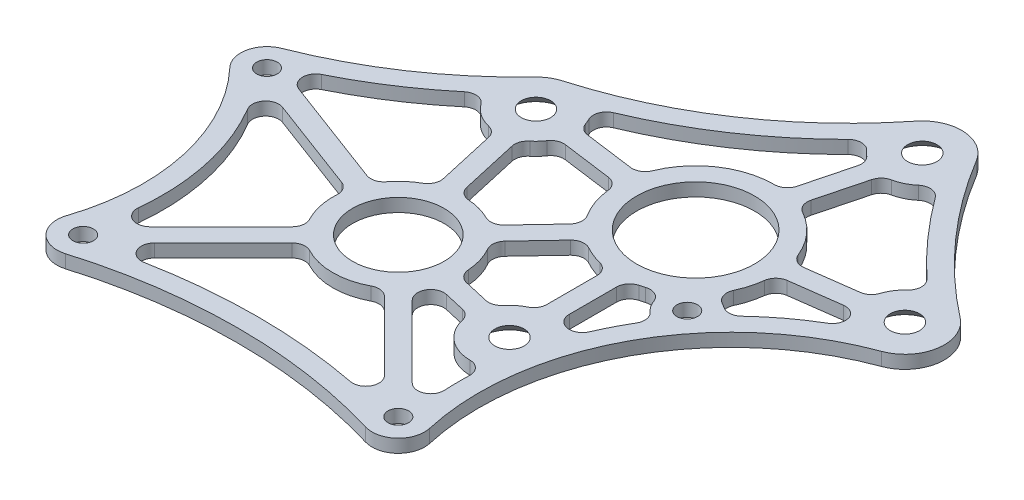
from build123d import *
from build123d.topology import SkipClean

# Parameters (mm, degrees)
LOWEREDBALLAST_DECK_MOUNT_START         = 6.35
LOWEREDBALLAST_DECK_MOUNT_OUTLINE_R     = 2.5527
LOWEREDBALLAST_DECK_MOUNT_OUTLINE_R_2   = 2.4892
LOWEREDBALLAST_DECK_MOUNT_OUTLINE_R_3   = 14.2875
LOWEREDBALLAST_DECK_MOUNT_OUTLINE_R_4   = 8.73125
LOWEREDBALLAST_DECK_MOUNT_DEPTH         = 5.9944
LOWEREDBALLAST_DECK_MOUNT_2_OUTLINE_R   = 8.73125
LOWEREDBALLAST_DECK_MOUNT_2_OUTLINE_R_2 = 7.14375
LOWEREDBALLAST_DECK_MOUNT_2_DEPTH       = 2.2098
BODY_MOVE_COPY2_START                   = 12.3444
BODY_MOVE_COPY2_OUTLINE_W               = 5.9944
BODY_MOVE_COPY2_OUTLINE_H               = 321.85
BODY_MOVE_COPY2_DEPTH                   = 184.5056
BODY_MOVE_COPY2_START_2                 = 3.175
BODY_MOVE_COPY2_2_OUTLINE_W             = 5.9944
BODY_MOVE_COPY2_2_OUTLINE_H             = 131.35
BODY_MOVE_COPY2_2_DEPTH                 = 9.1694
BODY_MOVE_COPY2_3_DEPTH                 = 3.175
BODY_MOVE_COPY2_START_3                 = 8.5598
BODY_MOVE_COPY2_4_DEPTH                 = 3.7846
BODY_MOVE_COPY2_START_4                 = 6.35
BODY_MOVE_COPY2_5_OUTLINE_R             = 2.4892
BODY_MOVE_COPY2_5_OUTLINE_R_2           = 2.5527
BODY_MOVE_COPY2_5_DEPTH                 = 5.9944
BODY_MOVE_COPY2_6_DEPTH                 = 2.2098
SKETCH2_R                               = 2.4892
SKETCH2_R_2                             = 11.0871
BOSS_EXTRUDE2_DEPTH                     = 3.175
BOSS_EXTRUDE3_DEPTH                     = 3.175
CSK_FOR_M6_SFHCS1_AT_2_COUNT            = 2
CSK_FOR_M6_SFHCS1_AT_2_PITCH            = 67.31314879
CSK_FOR_M6_SFHCS1_AT_3_COUNT            = 2
CSK_FOR_M6_SFHCS1_AT_3_PITCH            = 89.2
CSK_FOR_M6_SFHCS1_AT_4_COUNT            = 2
CSK_FOR_M6_SFHCS1_AT_4_PITCH            = 67.750719553
SKETCH9_R                               = 14.2621
CUT_EXTRUDE1_DEPTH                      = 127.63845982
SKETCH11_R                              = 15.8496
CUT_EXTRUDE3_DEPTH                      = 127.63845982
SKETCH12_W                              = 4.7625
SKETCH12_H                              = 16.902473543
BOSS_EXTRUDE4_DEPTH                     = 3.175
FILLET1_R                               = 3.175
BOSS_EXTRUDE10_DEPTH                    = 3.175


# Read off the part's stored shape, not the designer's step: LoweredBallast_Deck_Mount, Body-Move/Copy2
with BuildPart() as part:
    # LoweredBallast_Deck_Mount outline → LoweredBallast_Deck_Mount (new body)
    with BuildSketch(Plane.YZ.offset(LOWEREDBALLAST_DECK_MOUNT_START)):
        with BuildLine():
            Line((6.35, 95.898234913), (6.35, -95.898234913))
            ThreePointArc((6.35, -95.898234913), (5.815203263, -101.082988202), (4.233333333, -106.049411638))
            ThreePointArc((4.233333333, -106.049411638), (6.894743879, -120.105256121), (20.950588362, -122.766666667))
            ThreePointArc((20.950588362, -122.766666667), (25.917011798, -121.184796737), (31.101765087, -120.65))
            Line((31.101765087, -120.65), (104.656174089, -120.65))
            ThreePointArc((104.656174089, -120.65), (107.566222296, -120.194577963), (110.197992271, -118.871862348))
            Line((110.197992271, -118.871862348), (192.866818182, -59.73364846))
            ThreePointArc((192.866818182, -59.73364846), (195.795874901, -56.342231371), (196.85, -51.986786112))
            Line((196.85, -51.986786112), (196.85, 51.986786112))
            ThreePointArc((196.85, 51.986786112), (195.795874901, 56.342231371), (192.866818182, 59.73364846))
            Line((192.866818182, 59.73364846), (110.197992271, 118.871862348))
            ThreePointArc((110.197992271, 118.871862348), (107.566222296, 120.194577963), (104.656174089, 120.65))
            Line((104.656174089, 120.65), (31.101765087, 120.65))
            ThreePointArc((31.101765087, 120.65), (25.917011798, 121.184796737), (20.950588362, 122.766666667))
            ThreePointArc((20.950588362, 122.766666667), (6.894743879, 120.105256121), (4.233333333, 106.049411638))
            ThreePointArc((4.233333333, 106.049411638), (5.815203263, 101.082988202), (6.35, 95.898234913))
        make_face()
        with Locations((15.875, -111.125)):
            Circle(LOWEREDBALLAST_DECK_MOUNT_OUTLINE_R, mode=Mode.SUBTRACT)
        with Locations((50.8, -50.401562476)):
            Circle(LOWEREDBALLAST_DECK_MOUNT_OUTLINE_R_2, mode=Mode.SUBTRACT)
        with Locations((69.9008, -38.1)):
            Circle(LOWEREDBALLAST_DECK_MOUNT_OUTLINE_R_2, mode=Mode.SUBTRACT)
        with Locations((104.656174089, -111.125)):
            Circle(LOWEREDBALLAST_DECK_MOUNT_OUTLINE_R, mode=Mode.SUBTRACT)
        with Locations((127.0508, -50.8)):
            Circle(LOWEREDBALLAST_DECK_MOUNT_OUTLINE_R_2, mode=Mode.SUBTRACT)
        with Locations((187.325, -51.986786112)):
            Circle(LOWEREDBALLAST_DECK_MOUNT_OUTLINE_R, mode=Mode.SUBTRACT)
        with Locations((15.875, 0)):
            Circle(LOWEREDBALLAST_DECK_MOUNT_OUTLINE_R, mode=Mode.SUBTRACT)
        with Locations((50.8, 50.401562476)):
            Circle(LOWEREDBALLAST_DECK_MOUNT_OUTLINE_R_2, mode=Mode.SUBTRACT)
        with Locations((57.15, 0)):
            Circle(LOWEREDBALLAST_DECK_MOUNT_OUTLINE_R_3, mode=Mode.SUBTRACT)
        with Locations((69.9008, 38.1)):
            Circle(LOWEREDBALLAST_DECK_MOUNT_OUTLINE_R_2, mode=Mode.SUBTRACT)
        with Locations((15.875, 111.125)):
            Circle(LOWEREDBALLAST_DECK_MOUNT_OUTLINE_R, mode=Mode.SUBTRACT)
        with Locations((108.0008, 0)):
            Circle(LOWEREDBALLAST_DECK_MOUNT_OUTLINE_R_4, mode=Mode.SUBTRACT)
        with Locations((127.0508, 50.8)):
            Circle(LOWEREDBALLAST_DECK_MOUNT_OUTLINE_R_2, mode=Mode.SUBTRACT)
        with Locations((187.325, 51.986786112)):
            Circle(LOWEREDBALLAST_DECK_MOUNT_OUTLINE_R, mode=Mode.SUBTRACT)
        with Locations((104.656174089, 111.125)):
            Circle(LOWEREDBALLAST_DECK_MOUNT_OUTLINE_R, mode=Mode.SUBTRACT)
    extrude(amount=LOWEREDBALLAST_DECK_MOUNT_DEPTH)

    # LoweredBallast_Deck_Mount 2 outline → LoweredBallast_Deck_Mount 2 (add)
    with BuildSketch(Plane.YZ.offset(LOWEREDBALLAST_DECK_MOUNT_START)):
        with Locations((108.0008, 0)):
            Circle(LOWEREDBALLAST_DECK_MOUNT_2_OUTLINE_R)
        with Locations((108.0008, 0)):
            Circle(LOWEREDBALLAST_DECK_MOUNT_2_OUTLINE_R_2, mode=Mode.SUBTRACT)
    extrude(amount=LOWEREDBALLAST_DECK_MOUNT_2_DEPTH)

    # Body-Move/Copy2 outline → Body-Move/Copy2 (cut)
    with BuildSketch(Plane(origin=(0, 0, 0), x_dir=(1, 0, 0), z_dir=(0, 1, 0)).offset(BODY_MOVE_COPY2_START)):
        with Locations((9.3472, 35.925)):
            Rectangle(BODY_MOVE_COPY2_OUTLINE_W, BODY_MOVE_COPY2_OUTLINE_H)
    extrude(amount=BODY_MOVE_COPY2_DEPTH, mode=Mode.SUBTRACT)

    # Body-Move_Copy2 2 outline → Body-Move_Copy2 2 (cut)
    with BuildSketch(Plane(origin=(0, 0, 0), x_dir=(1, 0, 0), z_dir=(0, 1, 0)).offset(BODY_MOVE_COPY2_START_2)):
        with BuildLine():
            ThreePointArc((6.35, 104.72808491), (7.14375, 108.0008), (6.35, 111.27351509))
            Line((6.35, 111.27351509), (6.35, 104.72808491))
        make_face()
        with BuildLine():
            Line((6.35, 69.948834175), (6.35, 44.351165825))
            ThreePointArc((6.35, 44.351165825), (9.758314431, 46.714102544), (12.3444, 49.956360803))
            Line((12.3444, 49.956360803), (12.3444, 64.343639197))
            ThreePointArc((12.3444, 64.343639197), (9.758314431, 67.585897456), (6.35, 69.948834175))
        make_face()
        with Locations((9.3472, -59.325)):
            Rectangle(BODY_MOVE_COPY2_2_OUTLINE_W, BODY_MOVE_COPY2_2_OUTLINE_H)
    extrude(amount=BODY_MOVE_COPY2_2_DEPTH, mode=Mode.SUBTRACT)

    # Body-Move_Copy2 3 outline → Body-Move_Copy2 3 (cut)
    with BuildSketch(Plane(origin=(0, 0, 0), x_dir=(1, 0, 0), z_dir=(0, 1, 0)).offset(BODY_MOVE_COPY2_START_2)):
        with BuildLine():
            ThreePointArc((6.35, 111.27351509), (7.14375, 108.0008), (6.35, 104.72808491))
            Line((6.35, 104.72808491), (6.35, 69.948834175))
            ThreePointArc((6.35, 69.948834175), (9.758314431, 67.585897456), (12.3444, 64.343639197))
            Line((12.3444, 64.343639197), (12.3444, 120.65))
            Line((12.3444, 120.65), (6.35, 120.65))
            Line((6.35, 120.65), (6.35, 111.27351509))
        make_face()
    extrude(amount=BODY_MOVE_COPY2_3_DEPTH, mode=Mode.SUBTRACT)

    # Body-Move_Copy2 4 outline → Body-Move_Copy2 4 (cut)
    with BuildSketch(Plane(origin=(0, 0, 0), x_dir=(1, 0, 0), z_dir=(0, 1, 0)).offset(BODY_MOVE_COPY2_START_3)):
        with BuildLine():
            ThreePointArc((6.35, 111.27351509), (7.14375, 108.0008), (6.35, 104.72808491))
            Line((6.35, 104.72808491), (6.35, 102.008118917))
            ThreePointArc((6.35, 102.008118917), (8.73125, 108.0008), (6.35, 113.993481083))
            Line((6.35, 113.993481083), (6.35, 111.27351509))
        make_face()
    extrude(amount=BODY_MOVE_COPY2_4_DEPTH, mode=Mode.SUBTRACT)

    # Body-Move_Copy2 5 outline → Body-Move_Copy2 5 (add)
    with SkipClean():  # the faces are left unmerged after this step: merging them gives an invalid solid
        with BuildSketch(Plane(origin=(0, 0, 0), x_dir=(1, 0, 0), z_dir=(0, 1, 0)).offset(BODY_MOVE_COPY2_START_4)):
            with BuildLine():
                Line((8.5598, 106.279012986), (8.5598, 68.589513985))
                ThreePointArc((8.5598, 68.589513985), (14.001606829, 59.993881585), (12.3444, 49.956360803))
                Line((12.3444, 49.956360803), (12.3444, 6.35))
                Line((12.3444, 6.35), (95.898234913, 6.35))
                ThreePointArc((95.898234913, 6.35), (101.082988202, 5.815203263), (106.049411638, 4.233333333))
                ThreePointArc((106.049411638, 4.233333333), (120.105256121, 6.894743879), (122.766666667, 20.950588362))
                ThreePointArc((122.766666667, 20.950588362), (121.184796737, 25.917011798), (120.65, 31.101765087))
                Line((120.65, 31.101765087), (120.65, 104.656174089))
                ThreePointArc((120.65, 104.656174089), (120.194577963, 107.566222296), (118.871862348, 110.197992271))
                Line((118.871862348, 110.197992271), (59.73364846, 192.866818182))
                ThreePointArc((59.73364846, 192.866818182), (56.342231371, 195.795874901), (51.986786112, 196.85))
                Line((51.986786112, 196.85), (-51.986786112, 196.85))
                ThreePointArc((-51.986786112, 196.85), (-56.342231371, 195.795874901), (-59.73364846, 192.866818182))
                Line((-59.73364846, 192.866818182), (-118.871862348, 110.197992271))
                ThreePointArc((-118.871862348, 110.197992271), (-120.194577963, 107.566222296), (-120.65, 104.656174089))
                Line((-120.65, 104.656174089), (-120.65, 31.101765087))
                ThreePointArc((-120.65, 31.101765087), (-121.184796737, 25.917011798), (-122.766666667, 20.950588362))
                ThreePointArc((-122.766666667, 20.950588362), (-120.105256121, 6.894743879), (-106.049411638, 4.233333333))
                ThreePointArc((-106.049411638, 4.233333333), (-101.082988202, 5.815203263), (-95.898234913, 6.35))
                Line((-95.898234913, 6.35), (6.35, 6.35))
                Line((6.35, 6.35), (6.35, 44.351165825))
                ThreePointArc((6.35, 44.351165825), (-14.2875, 57.15), (6.35, 69.948834175))
                Line((6.35, 69.948834175), (6.35, 102.008118917))
                ThreePointArc((6.35, 102.008118917), (-7.754719082, 112.013163208), (8.5598, 106.279012986))
            make_face()
            with Locations((-38.1, 69.9008)):
                Circle(BODY_MOVE_COPY2_5_OUTLINE_R, mode=Mode.SUBTRACT)
            with Locations((-111.125, 15.875)):
                Circle(BODY_MOVE_COPY2_5_OUTLINE_R_2, mode=Mode.SUBTRACT)
            with Locations((0, 15.875)):
                Circle(BODY_MOVE_COPY2_5_OUTLINE_R_2, mode=Mode.SUBTRACT)
            with Locations((-111.125, 104.656174089)):
                Circle(BODY_MOVE_COPY2_5_OUTLINE_R_2, mode=Mode.SUBTRACT)
            with Locations((-50.401562476, 50.8)):
                Circle(BODY_MOVE_COPY2_5_OUTLINE_R, mode=Mode.SUBTRACT)
            with Locations((-51.986786112, 187.325)):
                Circle(BODY_MOVE_COPY2_5_OUTLINE_R_2, mode=Mode.SUBTRACT)
            with Locations((-50.8, 127.0508)):
                Circle(BODY_MOVE_COPY2_5_OUTLINE_R, mode=Mode.SUBTRACT)
            with Locations((111.125, 104.656174089)):
                Circle(BODY_MOVE_COPY2_5_OUTLINE_R_2, mode=Mode.SUBTRACT)
            with Locations((111.125, 15.875)):
                Circle(BODY_MOVE_COPY2_5_OUTLINE_R_2, mode=Mode.SUBTRACT)
            with Locations((50.401562476, 50.8)):
                Circle(BODY_MOVE_COPY2_5_OUTLINE_R, mode=Mode.SUBTRACT)
            with Locations((38.1, 69.9008)):
                Circle(BODY_MOVE_COPY2_5_OUTLINE_R, mode=Mode.SUBTRACT)
            with Locations((51.986786112, 187.325)):
                Circle(BODY_MOVE_COPY2_5_OUTLINE_R_2, mode=Mode.SUBTRACT)
            with Locations((50.8, 127.0508)):
                Circle(BODY_MOVE_COPY2_5_OUTLINE_R, mode=Mode.SUBTRACT)
        extrude(amount=BODY_MOVE_COPY2_5_DEPTH)

    # Body-Move_Copy2 6 outline → Body-Move_Copy2 6 (add)
    with SkipClean():  # the faces are left unmerged after this step: merging them gives an invalid solid
        with BuildSketch(Plane(origin=(0, 0, 0), x_dir=(1, 0, 0), z_dir=(0, 1, 0)).offset(BODY_MOVE_COPY2_START_4)):
            with BuildLine():
                ThreePointArc((6.35, 104.72808491), (-7.14375, 108.0008), (6.35, 111.27351509))
                Line((6.35, 111.27351509), (6.35, 113.993481083))
                ThreePointArc((6.35, 113.993481083), (-8.73125, 108.0008), (6.35, 102.008118917))
                Line((6.35, 102.008118917), (6.35, 104.72808491))
            make_face()
        extrude(amount=BODY_MOVE_COPY2_6_DEPTH)


with BuildPart() as body_2:
    # Sketch2 → Boss-Extrude2 (new body)
    with BuildSketch(Plane(origin=(0, 12.3444, 0), x_dir=(1, 0, 0), z_dir=(0, 1, 0))):
        with BuildLine():
            ThreePointArc((-44.129496351, -36.108097954), (-42.655468746, -42.523822386), (-36.285714286, -44.185299282))
            ThreePointArc((-36.285714286, -44.185299282), (0, -38.891284914), (36.285714286, -44.185299282))
            ThreePointArc((36.285714286, -44.185299282), (42.655468746, -42.523822386), (44.129496351, -36.108097954))
            ThreePointArc((44.129496351, -36.108097954), (42.775164497, -9.152814333), (55.418385239, 14.691902046))
            ThreePointArc((55.418385239, 14.691902046), (57.037562574, 20.239669338), (53.490115715, 24.802023769))
            ThreePointArc((53.490115715, 24.802023769), (50.38290358, 27.963007244), (50.100359739, 32.38643948))
            ThreePointArc((50.100359739, 32.38643948), (44.410724144, 49.657761114), (26.234915901, 50.214985411))
            ThreePointArc((26.234915901, 50.214985411), (-10.729896119, 32.563223651), (-51.060943402, 25.394636202))
            ThreePointArc((-51.060943402, 25.394636202), (-56.681249153, 21.444453674), (-55.418385239, 14.691902046))
            ThreePointArc((-55.418385239, 14.691902046), (-42.775164497, -9.152814333), (-44.129496351, -36.108097954))
        make_face()
        with Locations(Location((-50.8, 19.05, 0), (0, 0, 270))):
            Circle(SKETCH2_R, mode=Mode.SUBTRACT)
        with Locations(Location((50.8, 19.05, 0), (0, 0, 270))):
            Circle(SKETCH2_R, mode=Mode.SUBTRACT)
        with Locations(Location((38.1, -38.1, 0), (0, 0, 270))):
            Circle(SKETCH2_R, mode=Mode.SUBTRACT)
        with Locations(Location((0, 0, 0), (0, 0, 270))):
            Circle(SKETCH2_R_2, mode=Mode.SUBTRACT)
        with Locations(Location((34.925, 36.960089768, 0), (0, 0, 270))):
            Circle(SKETCH2_R_2, mode=Mode.SUBTRACT)
        with Locations(Location((-38.1, -38.1, 0), (0, 0, 270))):
            Circle(SKETCH2_R, mode=Mode.SUBTRACT)
    extrude(amount=BOSS_EXTRUDE2_DEPTH)

    # Sketch5 → Boss-Extrude3 (add)
    with BuildSketch(Plane(origin=(0, 15.5194, 0), x_dir=(1, 0, 0), z_dir=(0, 1, 0))):
        with BuildLine():
            ThreePointArc((44.293527545, -36.699030141), (50.216262385, 5.917629746), (82.800587261, 34.016032909))
            ThreePointArc((82.800587261, 34.016032909), (88.936638085, 41.494929858), (85.364424768, 50.485164078))
            ThreePointArc((85.364424768, 50.485164078), (68.260535263, 66.492445081), (54.387680582, 85.368885008))
            ThreePointArc((54.387680582, 85.368885008), (46.847390614, 89.964733629), (38.772161932, 86.391432763))
            ThreePointArc((38.772161932, 86.391432763), (15.876348295, 65.285679909), (-12.336409497, 52.105718477))
            ThreePointArc((-12.336409497, 52.105718477), (-14.626898281, 51.096693999), (-16.575465865, 49.525849118))
            ThreePointArc((-16.575465865, 49.525849118), (-33.499373895, 35.240882944), (-53.116496182, 24.962389148))
            ThreePointArc((-53.116496182, 24.962389148), (-52.106716527, 25.264096227), (-51.060943402, 25.394636202))
            ThreePointArc((-51.060943402, 25.394636202), (-28.677909992, 27.982287718), (-6.92104762, 33.841900732))
            ThreePointArc((-6.92104762, 33.841900732), (-6.501886535, 33.989480549), (-6.08315756, 34.138281966))
            ThreePointArc((-6.08315756, 34.138281966), (10.553530944, 41.216437766), (26.234915901, 50.214985411))
            ThreePointArc((26.234915901, 50.214985411), (44.410724144, 49.657761114), (50.100359739, 32.38643948))
            ThreePointArc((50.100359739, 32.38643948), (50.38290358, 27.963007244), (53.490115715, 24.802023769))
            ThreePointArc((53.490115715, 24.802023769), (57.037562574, 20.239669338), (55.418385239, 14.691902046))
            ThreePointArc((55.418385239, 14.691902046), (42.775164497, -9.152814333), (44.129496351, -36.108097954))
            ThreePointArc((44.129496351, -36.108097954), (44.218650055, -36.401582649), (44.293527545, -36.699030141))
        make_face()
    extrude(amount=-BOSS_EXTRUDE3_DEPTH)

    # Sketch7 → CSK for M6 SFHCS1 (revolve, cut)
    with BuildSketch(Plane(origin=(-9.675, 12.3444, -42.960089768), x_dir=(0, 0, -1), z_dir=(1, 0, 0))):
        Polygon((0, 0), (0, 3.175), (3.3, 3.175), (3.3, 3.42), (6.72, 0), align=None)
    csk_for_m6_sfhcs1 = revolve(axis=Axis((-9.675, 5.9944, -42.960089768), (0, 1, 0)), mode=Mode.SUBTRACT)

    # CSK for M6 SFHCS1 at 2: CSK for M6 SFHCS1 ×2
    with Locations(*[Vector(0.8304469632604168, -1.939624427667078e-15, -0.5570976944949172) * (i * CSK_FOR_M6_SFHCS1_AT_2_PITCH) for i in range(1, CSK_FOR_M6_SFHCS1_AT_2_COUNT)]):
        add(csk_for_m6_sfhcs1, mode=Mode.SUBTRACT)

    # CSK for M6 SFHCS1 at 3: CSK for M6 SFHCS1 ×2
    with Locations(*[(i * CSK_FOR_M6_SFHCS1_AT_3_PITCH, 0, 0) for i in range(1, CSK_FOR_M6_SFHCS1_AT_3_COUNT)]):
        add(csk_for_m6_sfhcs1, mode=Mode.SUBTRACT)

    # CSK for M6 SFHCS1 at 4: CSK for M6 SFHCS1 ×2
    with Locations(*[Vector(0.6582955914566262, 2.621901067782497e-15, 0.7527595328315483) * (i * CSK_FOR_M6_SFHCS1_AT_4_PITCH) for i in range(1, CSK_FOR_M6_SFHCS1_AT_4_COUNT)]):
        add(csk_for_m6_sfhcs1, mode=Mode.SUBTRACT)

    # Sketch9 → Cut-Extrude1 (cut, through all)
    with BuildSketch(Plane(origin=(0, 15.5194, 0), x_dir=(1, 0, 0), z_dir=(0, 1, 0))):
        with Locations(Location((34.925, 36.960089768, 0), (0, 0, 270))):
            Circle(SKETCH9_R)
    extrude(amount=-CUT_EXTRUDE1_DEPTH, mode=Mode.SUBTRACT)

    # Sketch11 → Cut-Extrude3 (cut, through all)
    with BuildSketch(Plane(origin=(0, 15.5194, 0), x_dir=(1, 0, 0), z_dir=(0, 1, 0))):
        with BuildLine():
            ThreePointArc((44.643335962, 20.604988078), (22.305774109, 51.197032666), (49.995283586, 25.348803973))
            ThreePointArc((49.995283586, 25.348803973), (53.615883367, 24.741511299), (56.295291484, 22.231866042))
            ThreePointArc((56.295291484, 22.231866042), (64.531189221, 29.502789261), (73.862874106, 35.30071934))
            ThreePointArc((73.862874106, 35.30071934), (70.093058128, 44.288283101), (76.198286256, 51.88525647))
            ThreePointArc((76.198286256, 51.88525647), (64.699427023, 63.330180964), (54.694259063, 76.101503309))
            ThreePointArc((54.694259063, 76.101503309), (45.569120757, 70.957698099), (37.237226738, 77.306432083))
            ThreePointArc((37.237226738, 77.306432083), (18.529526065, 61.330676247), (-3.348061611, 50.080165302))
            ThreePointArc((-3.348061611, 50.080165302), (-4.723101719, 34.823485537), (-18.905963853, 40.611700671))
            ThreePointArc((-18.905963853, 40.611700671), (-31.661745687, 30.743137529), (-45.762939778, 22.916590788))
            ThreePointArc((-45.762939778, 22.916590788), (-44.622011524, 17.582022347), (-48.040642958, 13.330869934))
            ThreePointArc((-48.040642958, 13.330869934), (-38.126073623, -8.119683027), (-38.022566943, -31.750472134))
            ThreePointArc((-38.022566943, -31.750472134), (-33.613807905, -33.605939422), (-31.750617577, -38.011440178))
            ThreePointArc((-31.750617577, -38.011440178), (0, -34.128784914), (31.750617577, -38.011440178))
            ThreePointArc((31.750617577, -38.011440178), (33.816682655, -33.412176142), (38.583221926, -31.768412792))
            ThreePointArc((38.583221926, -31.768412792), (38.037816989, -24.358697017), (38.331945151, -16.934759851))
            ThreePointArc((38.331945151, -16.934759851), (25.624139295, -5.985740047), (41.761296086, -1.407363149))
            ThreePointArc((41.761296086, -1.407363149), (44.895836765, 6.009069019), (48.913465309, 12.986709898))
            ThreePointArc((48.913465309, 12.986709898), (45.260794095, 15.945213704), (44.643335962, 20.604988078))
        make_face()
        with Locations(Location((0, 0, 0), (0, 0, 270))):
            Circle(SKETCH11_R, mode=Mode.SUBTRACT)
    extrude(amount=-CUT_EXTRUDE3_DEPTH, mode=Mode.SUBTRACT)


with BuildPart() as cut_extrude3_piece_1:
    # of the separate pieces the step leaves, piece 1, a body of its own (cut_extrude3_pieces)
    add(body_2.part.solids().sort_by_distance((-55.418385239, 12.3444, -14.691902046))[0])



with BuildPart() as cut_extrude3_piece_2:
    # of the separate pieces the step leaves, piece 2, a body of its own (cut_extrude3_pieces)
    add(body_2.part.solids().sort_by_distance((0, 12.3444, 15.8496))[0])


with BuildPart() as cut_extrude3_piece_1_1:
    add(cut_extrude3_piece_1.part)

    add(cut_extrude3_piece_2.part)  # Boss-Extrude4 merges Cut-Extrude3 piece 2
    # Sketch12 → Boss-Extrude4 (add)
    with BuildSketch(Plane(origin=(0, 15.5194, 0), x_dir=(1, 0, 0), z_dir=(0, 1, 0))):
        Polygon((41.601462152, 72.132513724), (37.365894941, 55.827454105), (41.975407588, 54.630040475), (46.210974799, 70.935100094), align=None)
        with Locations((34.925, 9.633868132)):
            Rectangle(SKETCH12_W, SKETCH12_H)
        Polygon((70.067310184, 44.090456233), (53.313980756, 41.836645099), (53.948955671, 37.116664897), (70.702285099, 39.370476031), align=None)
        Polygon((-5.325682963, 34.486066738), (-9.971816351, 33.43971556), (-5.765798047, 14.763651074), (-1.119664659, 15.810002252), align=None)
        Polygon((-46.12431029, 14.753440244), (-15.508109128, 3.272364808), (-13.835883737, 7.731632516), (-44.4520849, 19.212707952), align=None)
        Polygon((12.763948486, -9.396352441), (9.396352441, -12.763948486), (32.253741861, -35.621337907), (35.621337907, -32.253741861), align=None)
        Polygon((-12.763948486, -9.396352441), (-35.621337907, -32.253741861), (-32.253741861, -35.621337907), (-9.396352441, -12.763948486), align=None)
        Polygon((23.692184929, 21.605635341), (20.23063806, 24.876583143), (9.031382513, 13.024743762), (12.492929381, 9.75379596), align=None)
        Polygon((-0.217310184, 44.090456233), (-0.852285099, 39.370476031), (15.901044329, 37.116664897), (16.536019244, 41.836645099), align=None)
        Polygon((26.471730465, -3.65039327), (15.804505857, -1.194744643), (14.736098788, -5.83585578), (25.403323395, -8.291504406), align=None)
    extrude(amount=-BOSS_EXTRUDE4_DEPTH)

    # Fillet1
    # the kernel refuses this fillet: 3.175 mm, written as the material it adds along each edge
    with BuildSketch(Plane(origin=(-9.971816351, 15.5194, -33.43971556), x_dir=(0.2197062840794898, 3.4061707135412437e-15, 0.9755660657976898), z_dir=(0, -1, 0)), Plane(origin=(70.067310184, 15.5194, -44.090456233), x_dir=(-0.9910719584243964, 0, 0.13332806615574813), z_dir=(0, -1, 0)), Plane(origin=(41.601462152, 15.5194, -72.132513724), x_dir=(-0.2514254341806693, 3.379323336506828e-15, 0.9678766714034708), z_dir=(0, -1, 0)), Plane(origin=(-0.852285099, 15.5194, -39.370476031), x_dir=(0.991071958424398, 0, 0.13332806615573545), z_dir=(0, -1, 0)), Plane(origin=(26.471730465, 15.5194, 3.65039327), x_dir=(-0.9745115247608875, 0, -0.2243374425017145), z_dir=(0, -1, 0))) as fillet1_piece_1:
        with BuildLine():
            CenterArc((2.197532222, 3.175), FILLET1_R, 205.944479772, 64.055520228)
            ThreePointArc((-0.657486232, 1.7859375), (-0.284026921, 0.90943085), (0, 0))
            Line((0, 0), (2.197532222, 0))
        make_face()
    extrude(amount=3.175)
    with BuildSketch(Plane(origin=(-5.325682963, 15.5194, -34.486066738), x_dir=(0.8395935255502635, -1.8966255999022055e-15, -0.5432151616570355), z_dir=(0, -1, 0)), Plane(origin=(32.54375, 15.5194, -1.182631361), x_dir=(-0.9384267372135655, 1.2062310531495959e-15, 0.3454783045036285), z_dir=(0, -1, 0)), Plane(origin=(70.702285099, 15.5194, -39.370476031), x_dir=(0.4675124819390111, 3.0864222639689223e-15, 0.8839864700498677), z_dir=(0, -1, 0)), Plane(origin=(-0.217310184, 15.5194, -44.090456233), x_dir=(-0.21727523773596194, -3.408071171275725e-15, -0.9761103785263125), z_dir=(0, -1, 0)), Plane(origin=(25.403323395, 15.5194, 8.291504406), x_dir=(0.12614833509184778, 3.4635892555132318e-15, 0.9920113898305578), z_dir=(0, -1, 0))) as fillet1_piece_2:
        with BuildLine():
            CenterArc((2.220305185, 3.15911661), FILLET1_R, 200.210995979, 64.055520228)
            Line((-0.759199706, 2.062222993), (0, 0))
            ThreePointArc((0, 0), (0.951559365, 0.047650171), (1.90311873, 0))
        make_face()
    extrude(amount=3.175)
    with BuildSketch(Plane(origin=(-1.119664659, 15.5194, -15.810002252), x_dir=(-0.21970628407948906, -3.4061707135412445e-15, -0.97556606579769), z_dir=(0, -1, 0)), Plane(origin=(12.492929381, 15.5194, -9.75379596), x_dir=(0.6868131868131873, -2.5377273062775804e-15, -0.7268339882115543), z_dir=(0, -1, 0)), Plane(origin=(-12.763948486, 15.5194, 9.396352441), x_dir=(-0.7071067811865476, 2.4688501310822744e-15, 0.7071067811865476), z_dir=(0, -1, 0)), Plane(origin=(9.396352441, 15.5194, 12.763948486), x_dir=(0.7071067811865476, 2.4688501310822567e-15, 0.7071067811865476), z_dir=(0, -1, 0)), Plane(origin=(-13.835883737, 15.5194, -7.731632516), x_dir=(-0.9363291775690447, -1.2259409439362343e-15, -0.3511234415883915), z_dir=(0, -1, 0))) as fillet1_piece_3:
        with BuildLine():
            CenterArc((2.525451149, 3.175), FILLET1_R, 196.981090387, 73.018909613)
            ThreePointArc((-0.511122651, 2.247721963), (-0.214644689, 1.133165255), (0, 0))
            Line((0, 0), (2.525451149, 0))
        make_face()
    extrude(amount=3.175)
    with BuildSketch(Plane(origin=(-5.765798047, 15.5194, -14.763651074), x_dir=(-0.21970628407948892, -3.406170713541245e-15, -0.97556606579769), z_dir=(0, -1, 0)), Plane(origin=(9.031382513, 15.5194, -13.024743762), x_dir=(0.6868131868131869, -2.5377273062775815e-15, -0.7268339882115546), z_dir=(0, -1, 0)), Plane(origin=(-9.396352441, 15.5194, 12.763948486), x_dir=(-0.7071067811865479, 2.468850131082273e-15, 0.7071067811865472), z_dir=(0, -1, 0)), Plane(origin=(-15.508109128, 15.5194, -3.272364808), x_dir=(-0.9363291775690448, -1.2259409439362337e-15, -0.3511234415883913), z_dir=(0, -1, 0)), Plane(origin=(15.804505857, 15.5194, 1.194744643), x_dir=(0.9745115247608875, 0, 0.2243374425017147), z_dir=(0, -1, 0))) as fillet1_piece_4:
        with BuildLine():
            CenterArc((2.525451149, -3.175), FILLET1_R, 90, 73.018909613)
            ThreePointArc((-0.511122651, -2.247721963), (-0.214644689, -1.133165255), (0, 0))
            Line((0, 0), (2.525451149, 0))
        make_face()
    extrude(amount=3.175)
    with BuildSketch(Plane(origin=(-3.348061611, 15.5194, -50.080165302), x_dir=(0.9293070777584775, -1.2894317840155282e-15, -0.3693079409219346), z_dir=(0, -1, 0))) as fillet1_piece_5:
        with BuildLine():
            CenterArc((4.142603764, 3.174415486), FILLET1_R, 175.005187252, 93.895376534)
            ThreePointArc((0.979660558, 3.450848614), (0.653749588, 1.678889295), (0, 0))
            ThreePointArc((0, 0), (2.04084156, 0.019581233), (4.08168312, 0))
        make_face()
    extrude(amount=3.175)
    with BuildSketch(Plane(origin=(38.331945151, 15.5194, 16.934759851), x_dir=(-0.06619877074124272, 3.4838226193564447e-15, 0.9978064555575638), z_dir=(0, -1, 0)), Plane(origin=(73.862874106, 15.5194, -35.30071934), x_dir=(-0.8765344879487116, 1.680586348383869e-15, 0.48133906078406924), z_dir=(0, -1, 0))) as fillet1_piece_6:
        with BuildLine():
            CenterArc((4.024037779, 3.173582082), FILLET1_R, 176.321891841, 91.965699503)
            ThreePointArc((0.855577637, 3.377261556), (0.583514236, 1.649180122), (0, 0))
            ThreePointArc((0, 0), (1.964580071, 0.029360054), (3.929160143, 0))
        make_face()
    extrude(amount=3.175)
    with BuildSketch(Plane(origin=(-18.905963853, 15.5194, -40.611700671), x_dir=(0.42463153189917796, 3.1610693965380883e-15, 0.9053662585478637), z_dir=(0, -1, 0))) as fillet1_piece_7:
        with BuildLine():
            CenterArc((4.185080835, 3.118201089), FILLET1_R, 165.250735228, 93.895376534)
            ThreePointArc((1.114699606, 3.926522875), (0.576186679, 1.957913841), (0, 0))
            ThreePointArc((0, 0), (1.793606072, 0.170396734), (3.587212144, 0))
        make_face()
    extrude(amount=3.175)
    with BuildSketch(Plane(origin=(37.237226738, 15.5194, -77.306432083), x_dir=(-0.6941849178487621, 2.5131567712777987e-15, 0.719796707294016), z_dir=(0, -1, 0))) as fillet1_piece_8:
        with BuildLine():
            CenterArc((4.142603764, -3.174415486), FILLET1_R, 91.099436213, 93.895376534)
            ThreePointArc((0.979660558, -3.450848614), (0.653749588, -1.678889295), (0, 0))
            ThreePointArc((0, 0), (2.04084156, -0.019581233), (4.08168312, 0))
        make_face()
    extrude(amount=3.175)
    with BuildSketch(Plane(origin=(54.694259063, 15.5194, -76.101503309), x_dir=(0.5799089560309444, 2.8444445177947304e-15, 0.8146812890419787), z_dir=(0, -1, 0))) as fillet1_piece_9:
        with BuildLine():
            CenterArc((4.181153904, 3.174609801), FILLET1_R, 174.589222929, 94.512493282)
            ThreePointArc((1.020300924, 3.473998242), (0.676739732, 1.688072445), (0, 0))
            ThreePointArc((0, 0), (2.065689131, 0.016193279), (4.131378262, 0))
        make_face()
    extrude(amount=3.175)
    with BuildSketch(Plane(origin=(76.198286256, 15.5194, -51.88525647), x_dir=(-0.8535627311744896, 1.81902714368946e-15, 0.5209900804717362), z_dir=(0, -1, 0))) as fillet1_piece_10:
        with BuildLine():
            CenterArc((4.224183716, 3.117124843), FILLET1_R, 164.530957816, 94.512493282)
            ThreePointArc((1.164199025, 3.963953452), (0.597636556, 1.977413552), (0, 0))
            ThreePointArc((0, 0), (1.81036445, 0.173625472), (3.620728899, 0))
        make_face()
    extrude(amount=3.175)
    with BuildSketch(Plane(origin=(56.295291484, 15.5194, -22.231866042), x_dir=(0.7090048380469952, -2.4622052643745405e-15, -0.7052036157209874), z_dir=(0, -1, 0))) as fillet1_piece_11:
        with BuildLine():
            CenterArc((3.257205331, -3.174071068), FILLET1_R, 91.386015869, 79.219774744)
            ThreePointArc((0.124786325, -2.655827714), (0.202950546, -1.321309649), (0, 0))
            ThreePointArc((0, 0), (1.590203928, -0.019234884), (3.180407856, 0))
        make_face()
    extrude(amount=3.175)
    with BuildSketch(Plane(origin=(49.995283586, 15.5194, -25.348803973), x_dir=(0.5196397107901797, -2.98307100564378e-15, -0.8543854931878809), z_dir=(0, -1, 0))) as fillet1_piece_12:
        with BuildLine():
            CenterArc((4.527490325, 3.15579387), FILLET1_R, 175.152784802, 88.541927997)
            ThreePointArc((1.363845505, 3.424078148), (0.935813877, 1.610911631), (0, 0))
            ThreePointArc((0, 0), (2.089396336, 0.115083134), (4.178792672, 0))
        make_face()
    extrude(amount=3.175)
    with BuildSketch(Plane(origin=(44.643335962, 15.5194, -20.604988078), x_dir=(0.04703570827444601, 3.4876169972539908e-15, 0.9988932085799368), z_dir=(0, -1, 0))) as fillet1_piece_13:
        with BuildLine():
            CenterArc((4.60712521, 3.038354965), FILLET1_R, 164.587386805, 88.541927997)
            ThreePointArc((1.546307986, 3.882169472), (0.880068182, 1.898499716), (0, 0))
            ThreePointArc((0, 0), (1.842850084, 0.27329007), (3.685700168, 0))
        make_face()
    extrude(amount=3.175)
    with BuildSketch(Plane(origin=(48.913465309, 15.5194, -12.986709898), x_dir=(-0.5307695406856334, 2.9590869666306255e-15, 0.8475161913971684), z_dir=(0, -1, 0))) as fillet1_piece_14:
        with BuildLine():
            CenterArc((3.257205331, 3.174071068), FILLET1_R, 189.394209387, 79.219774744)
            ThreePointArc((0.124786325, 2.655827714), (0.202950546, 1.321309649), (0, 0))
            ThreePointArc((0, 0), (1.590203928, 0.019234884), (3.180407856, 0))
        make_face()
    extrude(amount=3.175)
    with BuildSketch(Plane(origin=(32.54375, 15.5194, -18.085104904), x_dir=(0, 0, 1), z_dir=(0, -1, 0)), Plane(origin=(53.948955671, 15.5194, -37.116664897), x_dir=(0.9910719584243964, 0, -0.13332806615574785), z_dir=(0, -1, 0)), Plane(origin=(20.23063806, 15.5194, -24.876583143), x_dir=(-0.6868131868131866, 2.5377273062775827e-15, 0.726833988211555), z_dir=(0, -1, 0)), Plane(origin=(41.975407588, 15.5194, -54.630040475), x_dir=(0.2514254341806727, -3.3793233365068246e-15, -0.9678766714034697), z_dir=(0, -1, 0)), Plane(origin=(16.536019244, 15.5194, -41.836645099), x_dir=(-0.9910719584243984, 0, -0.13332806615573328), z_dir=(0, -1, 0))) as fillet1_piece_15:
        with BuildLine():
            CenterArc((2.618044846, 3.175), FILLET1_R, 194.49443927, 75.50556073)
            ThreePointArc((-0.455901051, 2.380341819), (-0.190007036, 1.197438133), (0, 0))
            Line((0, 0), (2.618044846, 0))
        make_face()
    extrude(amount=3.175)
    with BuildSketch(Plane(origin=(37.30625, 15.5194, -18.085104904), x_dir=(0.9821482621047971, 0, -0.18810845606863813), z_dir=(0, -1, 0)), Plane(origin=(53.313980756, 15.5194, -41.836645099), x_dir=(-0.31737694441678843, -3.310969885375683e-15, -0.9482994649121461), z_dir=(0, -1, 0)), Plane(origin=(23.692184929, 15.5194, -21.605635341), x_dir=(0.84305410653969, 1.8778190737209744e-15, 0.5378287584785377), z_dir=(0, -1, 0)), Plane(origin=(37.365894941, 15.5194, -55.827454105), x_dir=(-0.997893640990806, 0, -0.06487126690694651), z_dir=(0, -1, 0)), Plane(origin=(15.901044329, 15.5194, -37.116664897), x_dir=(0.055481087487482, 3.4861035437296935e-15, 0.9984597382624932), z_dir=(0, -1, 0))) as fillet1_piece_16:
        with BuildLine():
            CenterArc((2.625844358, 3.168552544), FILLET1_R, 190.842416395, 75.50556073)
            Line((-0.492476374, 2.571308196), (0, 0))
            ThreePointArc((0, 0), (1.211803712, 0.038633158), (2.423607424, 0))
        make_face()
    extrude(amount=3.175)
    with BuildSketch(Plane(origin=(46.210974799, 15.5194, -70.935100094), x_dir=(-0.25142543418067076, 3.3793233365068273e-15, 0.9678766714034703), z_dir=(0, -1, 0))) as fillet1_piece_17:
        with BuildLine():
            CenterArc((2.197532222, -3.175), FILLET1_R, 90, 64.055520228)
            ThreePointArc((-0.657486232, -1.7859375), (-0.284026921, -0.90943085), (0, 0))
            Line((0, 0), (2.197532222, 0))
        make_face()
    extrude(amount=3.175)

    # Sketch22 → Boss-Extrude10 (add)
    with BuildSketch(Plane(origin=(0, 15.5194, 0), x_dir=(1, 0, 0), z_dir=(0, 1, 0))):
        with BuildLine():
            Line((32.253741861, -35.621337907), (27.779016651, -31.146612696))
            ThreePointArc((27.779016651, -31.146612696), (28.338510483, -34.879991276), (24.933153736, -36.509314566))
            ThreePointArc((24.933153736, -36.509314566), (28.351835529, -37.21521943), (31.750617577, -38.011440178))
            ThreePointArc((31.750617577, -38.011440178), (31.886179967, -36.791970718), (32.253741861, -35.621337907))
        make_face()
        with BuildLine():
            Line((-27.779016651, -31.146612696), (-32.253741861, -35.621337907))
            ThreePointArc((-32.253741861, -35.621337907), (-31.886179967, -36.791970718), (-31.750617577, -38.011440178))
            ThreePointArc((-31.750617577, -38.011440178), (-28.351835529, -37.21521943), (-24.933153736, -36.509314566))
            ThreePointArc((-24.933153736, -36.509314566), (-28.338510483, -34.879991276), (-27.779016651, -31.146612696))
        make_face()
        with BuildLine():
            ThreePointArc((-44.552605678, 8.131211465), (-44.253852679, 11.787984755), (-40.705625238, 12.721433349))
            Line((-40.705625238, 12.721433349), (-46.12431029, 14.753440244))
            ThreePointArc((-46.12431029, 14.753440244), (-47.015042058, 13.951314544), (-48.040642958, 13.330869934))
            ThreePointArc((-48.040642958, 13.330869934), (-46.223323811, 10.780212179), (-44.552605678, 8.131211465))
        make_face()
        with BuildLine():
            Line((-44.4520849, 19.212707952), (-42.543914366, 18.497144002))
            ThreePointArc((-42.543914366, 18.497144002), (-44.599930596, 21.307378898), (-42.84217969, 24.313195702))
            ThreePointArc((-42.84217969, 24.313195702), (-44.297245646, 23.603779741), (-45.762939778, 22.916590788))
            ThreePointArc((-45.762939778, 22.916590788), (-44.813840731, 21.168583775), (-44.4520849, 19.212707952))
        make_face()
        with BuildLine():
            ThreePointArc((-38.022566943, -31.750472134), (-36.797415757, -31.88503626), (-35.621337907, -32.253741861))
            Line((-35.621337907, -32.253741861), (-31.679347723, -28.311751678))
            ThreePointArc((-31.679347723, -28.311751678), (-35.285250357, -28.935266267), (-37.083387721, -25.748103536))
            ThreePointArc((-37.083387721, -25.748103536), (-37.470875911, -28.762134089), (-38.022566943, -31.750472134))
        make_face()
        with BuildLine():
            ThreePointArc((15.369104484, -12.001508438), (14.836766437, -8.218048262), (18.326439894, -6.662370317))
            Line((18.326439894, -6.662370317), (14.736098788, -5.83585578))
            ThreePointArc((14.736098788, -5.83585578), (13.864791168, -7.679673562), (12.763948486, -9.396352441))
            Line((12.763948486, -9.396352441), (15.369104484, -12.001508438))
        make_face()
        with BuildLine():
            Line((32.716423723, -29.348827677), (35.621337907, -32.253741861))
            ThreePointArc((35.621337907, -32.253741861), (37.073193571, -31.833568116), (38.583221926, -31.768412792))
            ThreePointArc((38.583221926, -31.768412792), (38.312571412, -29.351385996), (38.131507611, -26.926002288))
            ThreePointArc((38.131507611, -26.926002288), (36.258178363, -30.001904165), (32.716423723, -29.348827677))
        make_face()
        with BuildLine():
            ThreePointArc((43.396978648, 2.775434242), (39.839694646, 0.922570502), (37.30625, 4.032077172))
            Line((37.30625, 4.032077172), (37.30625, 1.182631361))
            ThreePointArc((37.30625, 1.182631361), (39.712254626, 0.194640038), (41.761296086, -1.407363149))
            ThreePointArc((41.761296086, -1.407363149), (42.543408406, 0.698007354), (43.396978648, 2.775434242))
        make_face()
    extrude(amount=-BOSS_EXTRUDE10_DEPTH)


solid = cut_extrude3_piece_1_1.part
